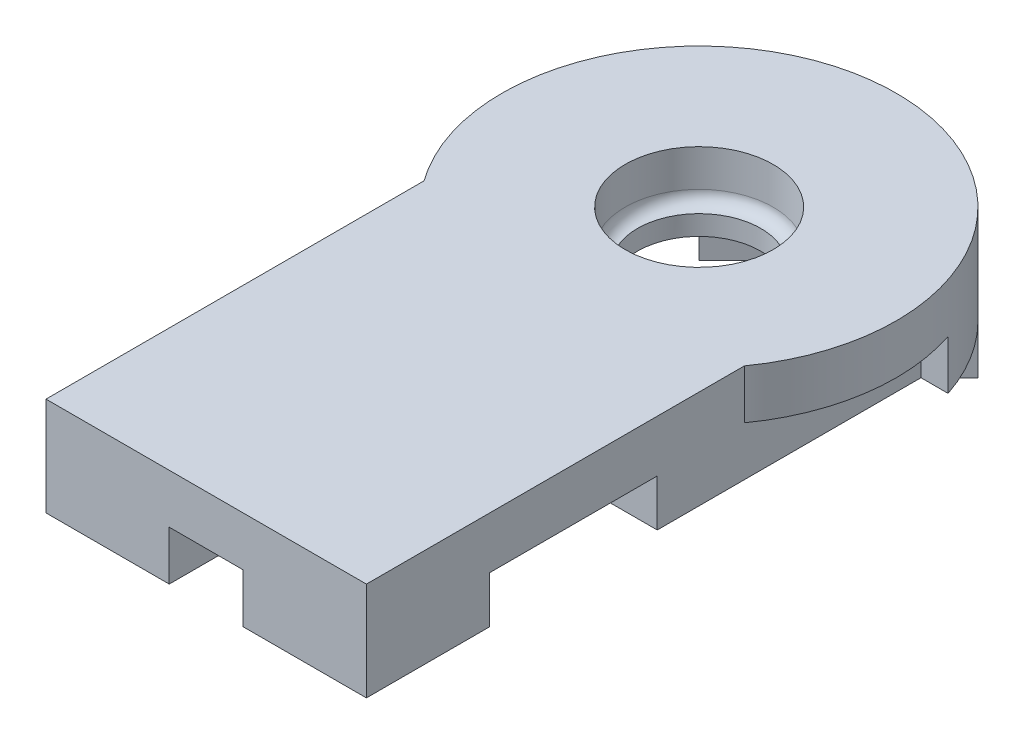
from build123d import *

# Parameters (mm, degrees)
BOSS_EXTRUDE1_DEPTH = 4
SKETCH2_R           = 2.5
CUT_EXTRUDE1_DEPTH  = 22.9089023
SKETCH3_R           = 3
CUT_EXTRUDE2_DEPTH  = 2
CUT_EXTRUDE3_DEPTH  = 1.2
CUT_EXTRUDE5_DEPTH  = 0.7
CUT_EXTRUDE8_START  = -2
CUT_EXTRUDE8_DEPTH  = 2
BOSS_EXTRUDE3_DEPTH = 2
FILLET3_R           = 0.5
CUT_EXTRUDE9_DEPTH  = 2
BOSS_EXTRUDE4_DEPTH = 1.9


with BuildPart() as part:
    # Sketch1 → Boss-Extrude1 (new body)
    with BuildSketch(Plane(origin=(0, 0, 0), x_dir=(1, 0, 0), z_dir=(0, 1, 0))):
        with BuildLine():
            Line((-6.5, -20), (6.5, -20))
            Line((6.5, -20), (6.5, -4.663689527))
            ThreePointArc((6.5, -4.663689527), (8, 0), (6.5, 4.663689527))
            ThreePointArc((6.5, 4.663689527), (0, 8), (-6.5, 4.663689527))
            ThreePointArc((-6.5, 4.663689527), (-8, 0), (-6.5, -4.663689527))
            Line((-6.5, -4.663689527), (-6.5, -20))
        make_face()
    extrude(amount=-BOSS_EXTRUDE1_DEPTH)

    # Sketch2 → Cut-Extrude1 (cut, through all)
    with BuildSketch(Plane(origin=(0, 0, 0), x_dir=(1, 0, 0), z_dir=(0, 1, 0))):
        with Locations(Location((0, 0, 0), (0, 0, 270))):
            Circle(SKETCH2_R)
    extrude(amount=-CUT_EXTRUDE1_DEPTH, mode=Mode.SUBTRACT)

    # Sketch3 → Cut-Extrude2 (cut)
    with BuildSketch(Plane(origin=(0, 0, 0), x_dir=(1, 0, 0), z_dir=(0, 1, 0))):
        with Locations(Location((0, 0, 0), (0, 0, 270))):
            Circle(SKETCH3_R)
    extrude(amount=-CUT_EXTRUDE2_DEPTH, mode=Mode.SUBTRACT)

    # Sketch4 → Cut-Extrude3 (cut)
    with BuildSketch(Plane.XZ.offset(4)):
        Polygon((2.5, -5.75), (-2.5, -5.75), (-5.75, -2.5), (-5.75, 6.25), (-4.4, 6.25), (-4.4, 8.2), (-5.660373569, 10), (-6.5, 10), (-6.5, 11.199110814), (-6.5, 15), (6.5, 15), (6.5, 11.199110814), (6.5, 10), (6.5, 8.2), (4.4, 8.2), (4.4, 6.25), (5.75, 6.25), (5.75, -2.5), align=None)
    extrude(amount=-CUT_EXTRUDE3_DEPTH, mode=Mode.SUBTRACT)

    # Sketch6 → Cut-Extrude5 (cut)
    with BuildSketch(Plane.XZ.offset(2.8)):
        Polygon((6.5, 8.2), (6.5, 15), (-6.5, 15), (-6.5, 11.199110814), (-5.660373569, 10), (-4.4, 8.2), (-4.4, 6.2), (4.4, 6.2), (4.4, 8.2), align=None)
    extrude(amount=-CUT_EXTRUDE5_DEPTH, mode=Mode.SUBTRACT)

    # Sketch10 → Cut-Extrude8 (cut)
    with BuildSketch(Plane.XZ.offset(4).offset(CUT_EXTRUDE8_START)):
        with BuildLine():
            Line((-6.5, 4.663689527), (-6.5, -2.5))
            Line((-6.5, -2.5), (-7.599342077, -2.5))
            ThreePointArc((-7.599342077, -2.5), (-7.907431546, 1.213476964), (-6.5, 4.663689527))
        make_face()
        with BuildLine():
            Line((6.5, 4.663689527), (6.5, -2.5))
            Line((6.5, -2.5), (7.599342077, -2.5))
            ThreePointArc((7.599342077, -2.5), (7.907431546, 1.213476964), (6.5, 4.663689527))
        make_face()
    extrude(amount=CUT_EXTRUDE8_DEPTH, mode=Mode.SUBTRACT)

    # Sketch11 → Boss-Extrude3 (add)
    with BuildSketch(Plane.XZ.offset(4)):
        with BuildLine():
            Line((-0.75, -7.964766161), (-0.75, -5.75))
            Line((-0.75, -5.75), (-2.5, -5.75))
            Line((-2.5, -5.75), (-4.125, -4.125))
            Line((-4.125, -4.125), (-5.656854249, -5.656854249))
            ThreePointArc((-5.656854249, -5.656854249), (-3.404931672, -7.239229262), (-0.75, -7.964766161))
        make_face()
        with BuildLine():
            Line((0.75, -7.964766161), (0.75, -5.75))
            Line((0.75, -5.75), (2.5, -5.75))
            Line((2.5, -5.75), (4.125, -4.125))
            Line((4.125, -4.125), (5.656854249, -5.656854249))
            ThreePointArc((5.656854249, -5.656854249), (3.404931672, -7.239229262), (0.75, -7.964766161))
        make_face()
    extrude(amount=BOSS_EXTRUDE3_DEPTH)

    # Fillet3
    fillet3_edges = [part.edges().sort_by_distance(p)[0] for p in [
        (0, -2, -3),
    ]]
    fillet(fillet3_edges, radius=FILLET3_R - 0.0001)  # a hair under: the kernel refuses the full size

    # Sketch12 → Cut-Extrude9 (cut)
    with BuildSketch(Plane.XZ.offset(4)):
        Polygon((0, 15), (1.5, 15), (1.5, 20), (-1.5, 20), (-1.5, 15), align=None)
    extrude(amount=-CUT_EXTRUDE9_DEPTH, mode=Mode.SUBTRACT)

    # Sketch13 → Boss-Extrude4 (add)
    with BuildSketch(Plane.XZ.offset(2.1)):
        Polygon((-6.5, 15), (-6.5, 10), (-5.660373569, 10), (-4.4, 8.2), (-4.4, 15), align=None)
    extrude(amount=BOSS_EXTRUDE4_DEPTH)


solid = part.part
